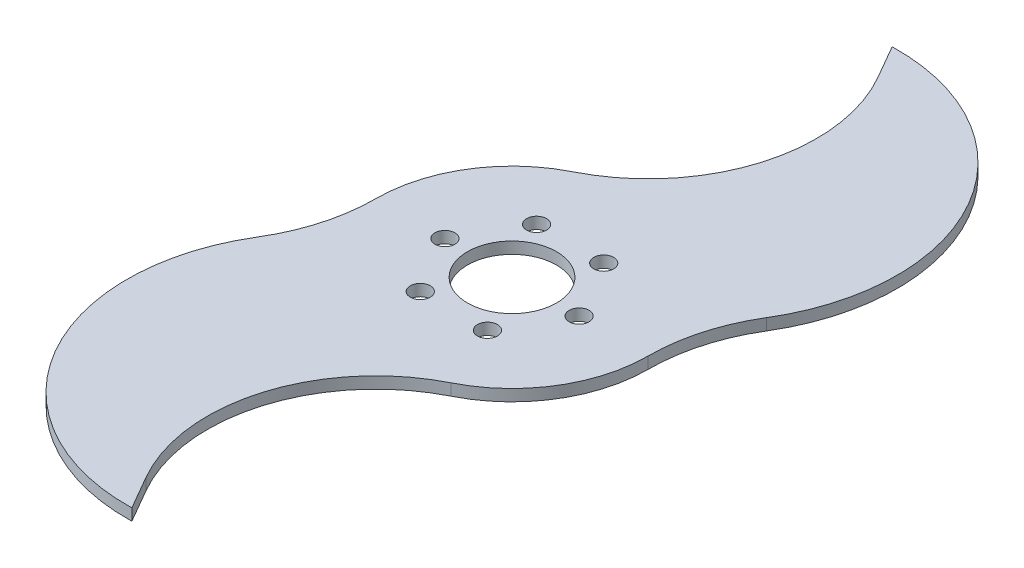
from build123d import *

# Parameters (mm, degrees)
BOSS_EXTRUDE1_DEPTH = 3.02
CIRPATTERN1_COUNT   = 2
SKETCH1_R           = 2.6
SKETCH1_R_2         = 11.6
CUT_EXTRUDE3_DEPTH  = 114.141227588


with BuildPart() as part:
    # Sketch2 → Boss-Extrude1 (new body)
    with BuildSketch(Plane(origin=(0, 0, 0), x_dir=(1, 0, 0), z_dir=(0, 1, 0))):
        with BuildLine():
            Line((-2.5, 101.569237469), (2.5, 92.908983431))
            ThreePointArc((2.5, 92.908983431), (6.521072048, 58.363973103), (-15.871963474, 31.75422453))
            ThreePointArc((-15.871963474, 31.75422453), (-18.665413158, -30.19689308), (35.5, 0))
            ThreePointArc((35.5, 0), (37.222873145, 12.5), (42.263015122, 24.067854629))
            ThreePointArc((42.263015122, 24.067854629), (42.89009321, 76.107775603), (-2.5, 101.569237469))
        make_face()
    extrude(amount=BOSS_EXTRUDE1_DEPTH)


with BuildPart() as cirpattern1_1:
    # CirPattern1: pattern copy
    add(part.part.rotate(Axis((0, -0.15, 0), (0, 1, 0)), 1 * 360 / CIRPATTERN1_COUNT))


with BuildPart() as part_1:
    add(part.part)

    # Combine1: union CirPattern1_1
    add(cirpattern1_1.part)

    # Sketch1 → Cut-Extrude3 (cut, through all)
    with BuildSketch(Plane(origin=(0, 0, 0), x_dir=(1, 0, 0), z_dir=(0, 1, 0))):
        with Locations((8.75, 15.155444566)):
            Circle(SKETCH1_R)
        with Locations((17.5, 0)):
            Circle(SKETCH1_R)
        with Locations((8.75, -15.155444566)):
            Circle(SKETCH1_R)
        with Locations((-8.75, -15.155444566)):
            Circle(SKETCH1_R)
        with Locations((-17.5, 0)):
            Circle(SKETCH1_R)
        with Locations((-8.75, 15.155444566)):
            Circle(SKETCH1_R)
        Circle(SKETCH1_R_2)
    extrude(amount=CUT_EXTRUDE3_DEPTH, mode=Mode.SUBTRACT)


solid = part_1.part
